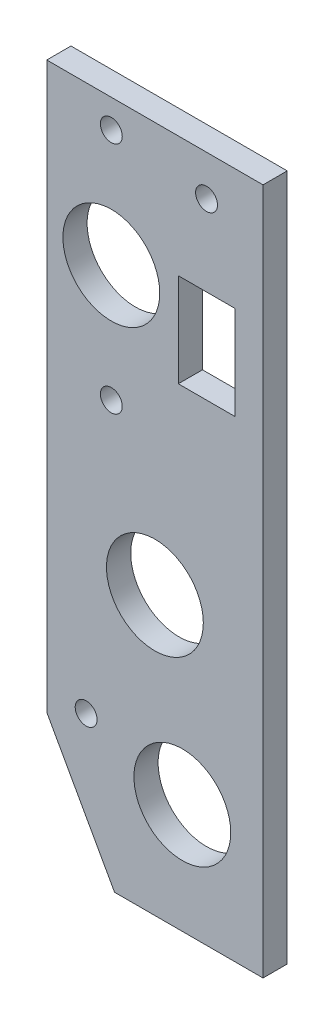
from build123d import *

# Parameters (mm, degrees)
BOSS_EXTRUDE1_DEPTH         = 4.7625
F_3_4_0_75_DIAMETER_HOLE1_D = 19.05
SKETCH4_W                   = 11.1125
SKETCH4_H                   = 18.415
CUT_EXTRUDE1_DEPTH          = 117.896221935
F_6_CLEARANCE_HOLE1_D       = 4.3053


with BuildPart() as part:
    # Sketch1 → Boss-Extrude1 (new body)
    with BuildSketch(Plane.XY):
        Polygon((-44.1325, -84.1375), (-30.7975, -108.1405), (-1.5875, -108.1405), (-1.5875, 26.9875), (-44.1325, 26.9875), align=None)
    extrude(amount=BOSS_EXTRUDE1_DEPTH)

    # 3/4 (0.75) Diameter Hole1 (through all)
    with Locations(Plane.XY.offset(4.7625)):
        with Locations((-31.4325, -1.620345612), (-17.4625, -86.5505), (-22.86, -53.5305)):
            Hole(F_3_4_0_75_DIAMETER_HOLE1_D / 2)

    # Sketch4 → Cut-Extrude1 (cut, through all)
    with BuildSketch(Plane.XY.offset(4.7625)):
        with Locations((-12.7, -6.0325)):
            Rectangle(SKETCH4_W, SKETCH4_H)
    extrude(amount=-CUT_EXTRUDE1_DEPTH, mode=Mode.SUBTRACT)

    # #6 Clearance Hole1 (through all)
    with Locations(Plane.XY.offset(4.7625)):
        with Locations((-36.3855, -80.4545), (-12.7, 19.05), (-31.4325, 21.404754388), (-31.4325, -24.620045612)):
            Hole(F_6_CLEARANCE_HOLE1_D / 2)


solid = part.part
